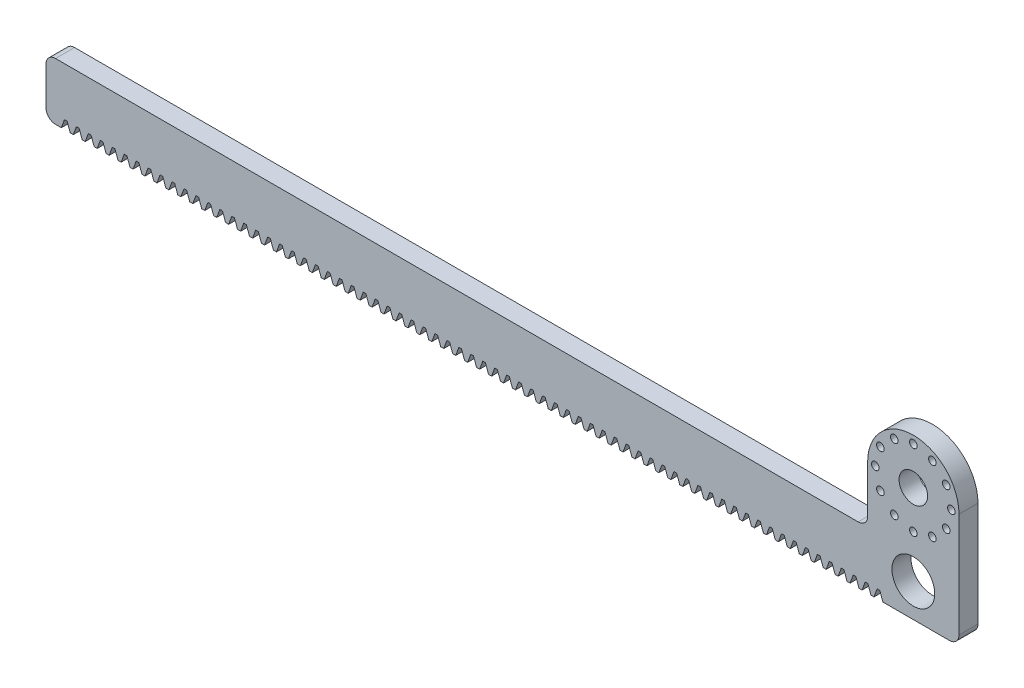
from build123d import *

# Parameters (mm, degrees)
SKETCH1_R           = 14.2875
SKETCH1_R_2         = 2.54
SKETCH1_R_3         = 9.525
BOSS_EXTRUDE1_DEPTH = 12.7
FILLET2_R           = 6.35
CUT_EXTRUDE1_DEPTH  = 619.994404175
LPATTERN1_COUNT     = 69
LPATTERN1_PITCH     = 7.979645331


with BuildPart() as part:
    # Sketch1 → Boss-Extrude1 (new body)
    with BuildSketch(Plane.XY):
        with BuildLine():
            Line((0, 38.1), (0, 0))
            Line((0, 0), (609.6, 0))
            Line((609.6, 0), (609.6, 76.2))
            ThreePointArc((609.6, 76.2), (579.12, 106.68), (548.64, 76.2))
            Line((548.64, 76.2), (548.64, 38.1))
            Line((548.64, 38.1), (40.53078, 38.1))
            Line((40.53078, 38.1), (0, 38.1))
        make_face()
        with Locations((579.12, 22.108627903)):
            Circle(SKETCH1_R, mode=Mode.SUBTRACT)
        with Locations((579.12, 50.8)):
            Circle(SKETCH1_R_2, mode=Mode.SUBTRACT)
        with Locations((566.42, 54.202954744)):
            Circle(SKETCH1_R_2, mode=Mode.SUBTRACT)
        with Locations((591.82, 54.202954744)):
            Circle(SKETCH1_R_2, mode=Mode.SUBTRACT)
        with Locations((557.122954744, 63.5)):
            Circle(SKETCH1_R_2, mode=Mode.SUBTRACT)
        with Locations((601.117045256, 63.5)):
            Circle(SKETCH1_R_2, mode=Mode.SUBTRACT)
        with Locations((553.72, 76.2)):
            Circle(SKETCH1_R_2, mode=Mode.SUBTRACT)
        with Locations((579.12, 76.2)):
            Circle(SKETCH1_R_3, mode=Mode.SUBTRACT)
        with Locations((604.52, 76.2)):
            Circle(SKETCH1_R_2, mode=Mode.SUBTRACT)
        with Locations((557.122954744, 88.9)):
            Circle(SKETCH1_R_2, mode=Mode.SUBTRACT)
        with Locations((601.117045256, 88.9)):
            Circle(SKETCH1_R_2, mode=Mode.SUBTRACT)
        with Locations((566.42, 98.197045256)):
            Circle(SKETCH1_R_2, mode=Mode.SUBTRACT)
        with Locations((591.82, 98.197045256)):
            Circle(SKETCH1_R_2, mode=Mode.SUBTRACT)
        with Locations((579.12, 101.6)):
            Circle(SKETCH1_R_2, mode=Mode.SUBTRACT)
    extrude(amount=BOSS_EXTRUDE1_DEPTH)

    # Fillet2
    fillet2_edges = [part.edges().sort_by_distance(p)[0] for p in [
        (0, 38.1, 6.35),
        (0, 0, 6.35),
        (548.64, 38.1, 6.35),
        (609.6, 0, 6.35),
    ]]
    fillet(fillet2_edges, radius=FILLET2_R)

    # Sketch2 → Cut-Extrude1 (cut, through all)
    with BuildSketch(Plane.XY.offset(12.7)):
        Polygon((552.86876001, 0), (558.8, 0), (556.719910111, 5.715), (554.948849899, 5.715), align=None)
    cut_extrude1 = extrude(amount=-CUT_EXTRUDE1_DEPTH, mode=Mode.SUBTRACT)

    # LPattern1: Cut-Extrude1 ×69
    with Locations(*[(-i * LPATTERN1_PITCH, 0, 0) for i in range(1, LPATTERN1_COUNT)]):
        add(cut_extrude1, mode=Mode.SUBTRACT)


solid = part.part
